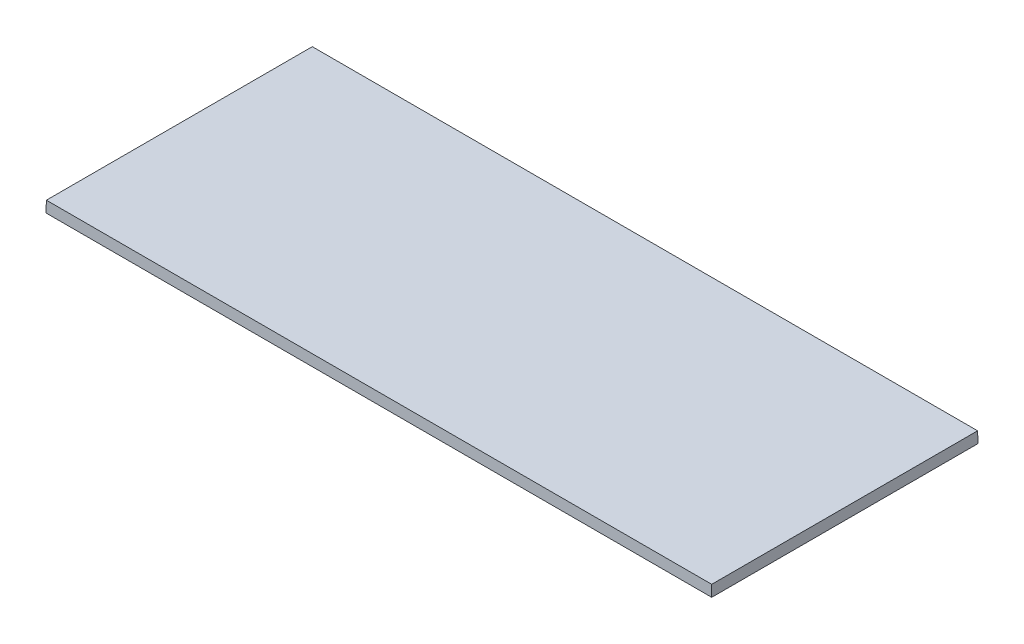
from build123d import *

# Parameters (mm, degrees)
SKETCH1_W           = 300
SKETCH1_H           = 120
BOSS_EXTRUDE1_DEPTH = 5
BOSS_EXTRUDE1_TAPER = 1
SHELL1_T            = -1


with BuildPart() as part:
    # Sketch1 → Boss-Extrude1 (new body)
    with BuildSketch(Plane(origin=(0, 0, 0), x_dir=(1, 0, 0), z_dir=(0, 1, 0))):
        Rectangle(SKETCH1_W, SKETCH1_H)
    extrude(amount=BOSS_EXTRUDE1_DEPTH, taper=BOSS_EXTRUDE1_TAPER)

    # Shell1
    shell1_openings = [part.faces().sort_by_distance(p)[0] for p in [
        (0, 0, 0),
    ]]
    offset(amount=SHELL1_T, openings=shell1_openings, kind=Kind.INTERSECTION)


solid = part.part
